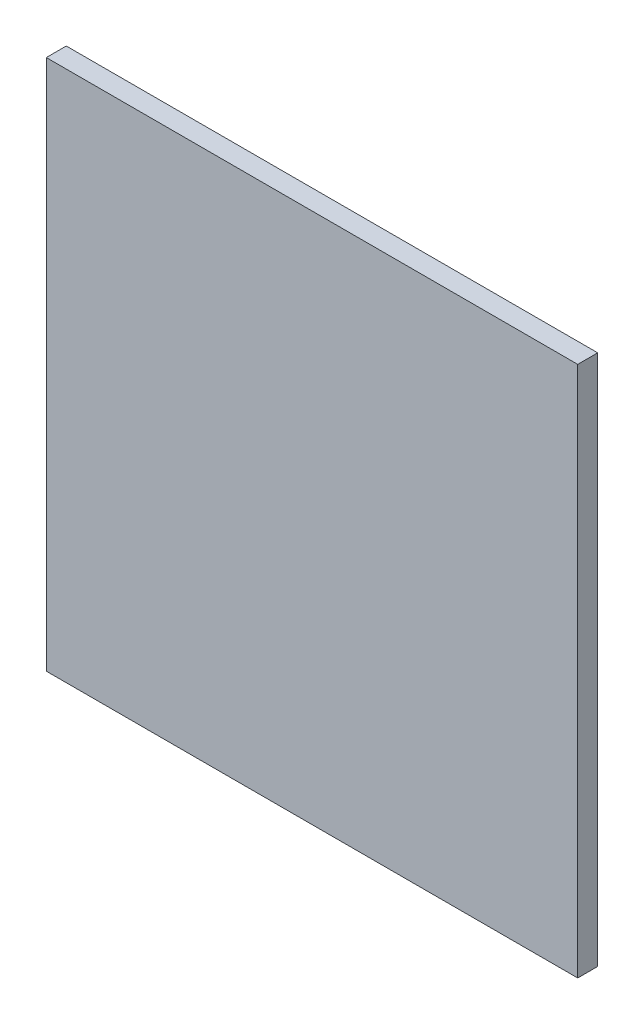
from build123d import *

# Parameters (mm, degrees)
SKICA1_W                = 79.8
SKICA1_H                = 79.8
P_IDAT_VYSUNUT_M1_DEPTH = 3


with BuildPart() as part:
    # Skica1 → Přidat vysunutím1 (new body)
    with BuildSketch(Plane.XY):
        with Locations((39.9, 39.9)):
            Rectangle(SKICA1_W, SKICA1_H)
    extrude(amount=P_IDAT_VYSUNUT_M1_DEPTH)


solid = part.part
